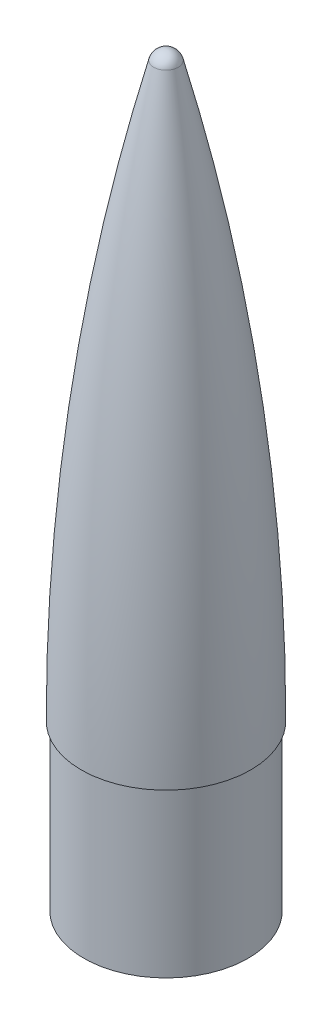
from build123d import *


with BuildPart() as part:
    # Sketch1 → Revolve1 (revolve)
    with BuildSketch(Plane.XY):
        with BuildLine():
            Line((0, 0), (32.5, 0))
            Line((32.5, 0), (32.5, 65))
            Line((32.5, 65), (33.5, 65))
            ThreePointArc((33.5, 65), (26.307013023, 179.02722165), (4.842089147, 291.246664625))
            ThreePointArc((4.842089147, 291.246664625), (3.063223537, 293.951792196), (0, 295))
            Line((0, 295), (0, 0))
        make_face()
    revolve(axis=Axis((0, 0, 0), (0, 1, 0)))


solid = part.part
